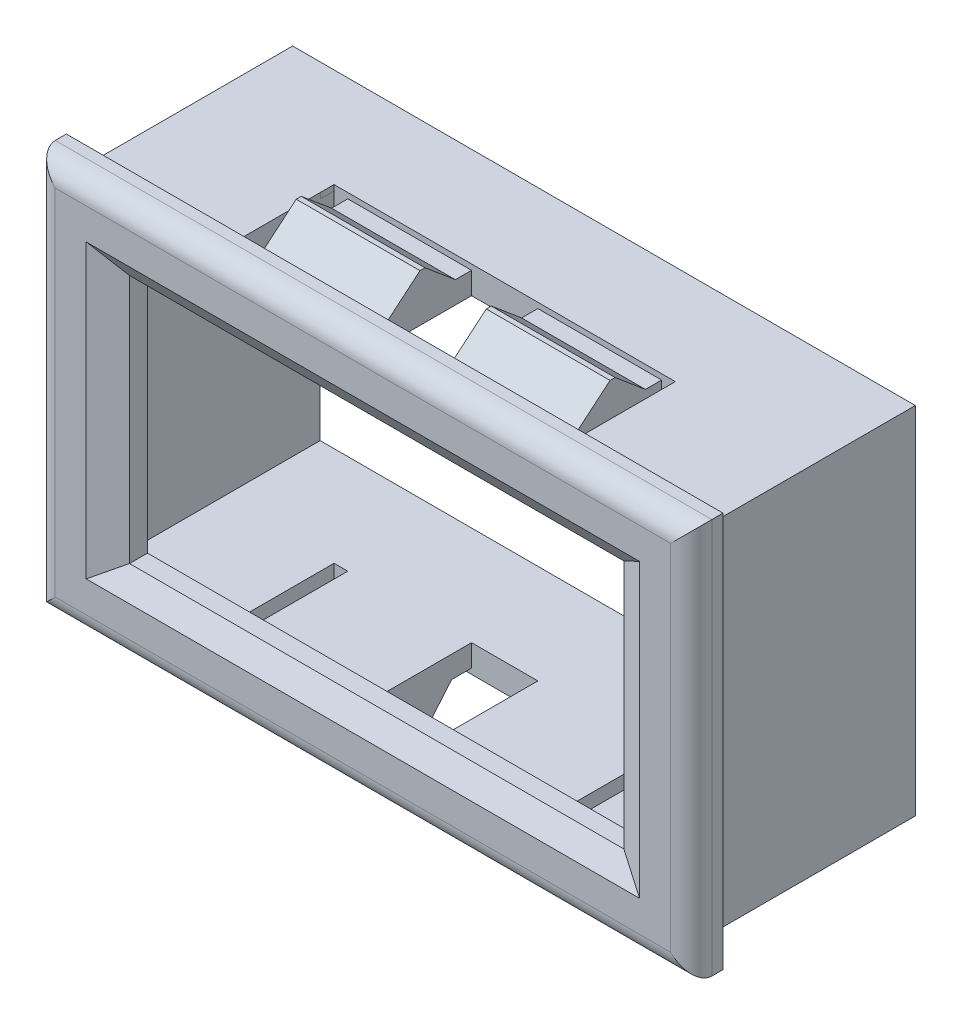
from build123d import *
from OCP.BRepFilletAPI import BRepFilletAPI_MakeChamfer

# Parameters (mm, degrees)
ESBO_O1_W                  = 47.75
ESBO_O1_H                  = 28.75
RESSALTO_EXTRUS_O1_DEPTH   = 17.53
ESBO_O3_W                  = 55.113346814
ESBO_O3_H                  = 32.23245858
ESBO_O3_W_2                = 45.28
ESBO_O3_H_2                = 25.85
CORTE_EXTRUS_O1_DEPTH      = 15.22
CORTE_EXTRUS_O2_DEPTH      = 17
CORTE_EXTRUS_O2_DEPTH_BACK = 33.22
ESBO_O4_W                  = 35.95
ESBO_O4_H                  = 18.14
ESBO_O5_W                  = 41.28
ESBO_O5_H                  = 21.85
CORTE_EXTRUS_O3_DEPTH      = 15.22
CHANFRO1_SIZE              = 1
CHANFRO1_SIZE2             = 2.144506921
CHANFRO2_SIZE              = 1
CHANFRO2_SIZE2             = 2.144506921
CHANFRO3_SIZE              = 1
CHANFRO3_SIZE2             = 1.539864964
FILETE1_R                  = 1.5
CORTE_EXTRUS_O4_DEPTH      = 15
CORTE_EXTRUS_O4_DEPTH_BACK = 44.22
CORTE_EXTRUS_O5_DEPTH      = 0.4
ESBO_O8_W                  = 24.82
ESBO_O8_H                  = 1
CORTE_EXTRUS_O6_DEPTH      = 0.4
ESBO_O9_W                  = 9
ESBO_O9_H                  = 6.324480946
RESSALTO_EXTRUS_O2_DEPTH   = 1.45
ESBO_O10_W                 = 9
ESBO_O10_H                 = 6.324480946
RESSALTO_EXTRUS_O3_DEPTH   = 1.45
ESBO_O11_W                 = 9
ESBO_O11_H                 = 6.324480946
RESSALTO_EXTRUS_O4_DEPTH   = 1.45
CHANFRO4_SIZE              = 3
CHANFRO4_SIZE2             = 3.575260778


with BuildPart() as part:
    # Esboço1 → Ressalto-extrusão1 (new body)
    with BuildSketch(Plane.XY):
        Rectangle(ESBO_O1_W, ESBO_O1_H)
    extrude(amount=RESSALTO_EXTRUS_O1_DEPTH)

    # Esboço3 → Corte-extrusão1 (cut)
    with BuildSketch(Plane(origin=(0, 0, 0), x_dir=(-1, 0, 0), z_dir=(0, 0, -1))):
        Rectangle(ESBO_O3_W, ESBO_O3_H)
        Rectangle(ESBO_O3_W_2, ESBO_O3_H_2, mode=Mode.SUBTRACT)
    extrude(amount=-CORTE_EXTRUS_O1_DEPTH, mode=Mode.SUBTRACT)

    # Esboço4 → Corte-extrusão2 (cut, two sides: drawn at the far end of the back side and taken through both)
    with BuildSketch(Plane.XY.offset(17.53).offset(-CORTE_EXTRUS_O2_DEPTH_BACK)):
        Rectangle(ESBO_O4_W, ESBO_O4_H)
    extrude(amount=CORTE_EXTRUS_O2_DEPTH + CORTE_EXTRUS_O2_DEPTH_BACK, mode=Mode.SUBTRACT)

    # Esboço5 → Corte-extrusão3 (cut)
    with BuildSketch(Plane(origin=(0, 0, 0), x_dir=(-1, 0, 0), z_dir=(0, 0, -1))):
        Rectangle(ESBO_O5_W, ESBO_O5_H)
    extrude(amount=-CORTE_EXTRUS_O3_DEPTH, mode=Mode.SUBTRACT)

    # Chanfro1
    chanfro1_edges = [part.edges().sort_by_distance(p)[0] for p in [
        (17.975, 0, 17.53),
    ]]
    chanfro1_side = [part.faces().sort_by_distance(p)[0] for p in [
        (17.975, 0, 16.375),
    ]]
    chamfer(chanfro1_edges, length=CHANFRO1_SIZE, length2=CHANFRO1_SIZE2, reference=chanfro1_side[0])

    # Chanfro2
    chanfro2_edges = [part.edges().sort_by_distance(p)[0] for p in [
        (-17.975, 0, 17.53),
    ]]
    chanfro2_side = [part.faces().sort_by_distance(p)[0] for p in [
        (-17.975, 0, 16.375),
    ]]
    chamfer(chanfro2_edges, length=CHANFRO2_SIZE, length2=CHANFRO2_SIZE2, reference=chanfro2_side[0])

    # Chanfro3: one chamfer whose edges measure the first distance from different faces: ONE call of the kernel's chamfer builder (chamfer() names one face for all edges)
    chanfro3_edges_1 = [part.edges().sort_by_distance(p)[0] for p in [
        (0, -9.07, 17.53),
    ]]
    chanfro3_side_1 = [part.faces().sort_by_distance(p)[0] for p in [
        (0, -9.07, 16.39568424),
    ]]
    chanfro3_edges_2 = [part.edges().sort_by_distance(p)[0] for p in [
        (0, 9.07, 17.53),
    ]]
    chanfro3_side_2 = [part.faces().sort_by_distance(p)[0] for p in [
        (0, 9.07, 16.39568424),
    ]]
    chanfro3 = BRepFilletAPI_MakeChamfer(part.part.solid().wrapped)
    for e in chanfro3_edges_1:
        chanfro3.Add(CHANFRO3_SIZE, CHANFRO3_SIZE2, e.wrapped, chanfro3_side_1[0].wrapped)  # the first distance lies on this face
    for e in chanfro3_edges_2:
        chanfro3.Add(CHANFRO3_SIZE, CHANFRO3_SIZE2, e.wrapped, chanfro3_side_2[0].wrapped)  # the first distance lies on this face
    add(Compound.cast(chanfro3.Shape()), mode=Mode.REPLACE)

    # Filete1
    filete1_edges = [part.edges().sort_by_distance(p)[0] for p in [
        (23.875, 0, 17.53),
        (0, 14.375, 17.53),
        (-23.875, 0, 17.53),
        (0, -14.375, 17.53),
    ]]
    fillet(filete1_edges, radius=FILETE1_R)

    # Esboço6 → Corte-extrusão4 (cut, two sides: drawn at the far end of the back side and taken through both)
    with BuildSketch(Plane(origin=(0, 12.925, 0), x_dir=(1, 0, 0), z_dir=(0, 1, 0)).offset(-CORTE_EXTRUS_O4_DEPTH_BACK)):
        Polygon((-11.41, -7.895519054), (-11.41, -7.22), (-12.41, -7.22), (-12.41, -15.22), (12.41, -15.22), (12.41, -7.22), (11.41, -7.22), (11.41, -7.895519054), (11.41, -14.544480946), (2.41, -14.544480946), (2.41, -7.22), (-2.41, -7.22), (-2.41, -14.544480946), (-11.41, -14.544480946), align=None)
    extrude(amount=CORTE_EXTRUS_O4_DEPTH + CORTE_EXTRUS_O4_DEPTH_BACK, mode=Mode.SUBTRACT)

    # Esboço7 → Corte-extrusão5 (cut)
    with BuildSketch(Plane(origin=(0, 12.925, 0), x_dir=(1, 0, 0), z_dir=(0, 1, 0))):
        Polygon((-12.410087555, -8.22), (12.410087555, -8.22), (12.41, -7.22), (-12.41, -7.22), align=None)
    extrude(amount=-CORTE_EXTRUS_O5_DEPTH, mode=Mode.SUBTRACT)

    # Esboço8 → Corte-extrusão6 (cut)
    with BuildSketch(Plane.XZ.offset(12.925)):
        with Locations((0, 7.72)):
            Rectangle(ESBO_O8_W, ESBO_O8_H)
    extrude(amount=-CORTE_EXTRUS_O6_DEPTH, mode=Mode.SUBTRACT)

    # Esboço9 → Ressalto-extrusão2 (add)
    with BuildSketch(Plane(origin=(0, 12.925, 0), x_dir=(1, 0, 0), z_dir=(0, 1, 0))):
        with Locations((-6.91, -11.382240473)):
            Rectangle(ESBO_O9_W, ESBO_O9_H)
    extrude(amount=RESSALTO_EXTRUS_O2_DEPTH)

    # Esboço10 → Ressalto-extrusão3 (add)
    with BuildSketch(Plane(origin=(0, 12.925, 0), x_dir=(1, 0, 0), z_dir=(0, 1, 0))):
        with Locations((6.91, -11.382240473)):
            Rectangle(ESBO_O10_W, ESBO_O10_H)
    extrude(amount=RESSALTO_EXTRUS_O3_DEPTH)

    # Esboço11 → Ressalto-extrusão4 (add)
    with BuildSketch(Plane.XZ.offset(12.925)):
        with Locations((6.91, 11.382240473)):
            Rectangle(ESBO_O11_W, ESBO_O11_H)
        Polygon((-2.41, 8.22), (-2.41, 14.544480946), (-6.91, 14.544480946), (-11.41, 14.544480946), (-11.41, 8.22), align=None)
    extrude(amount=RESSALTO_EXTRUS_O4_DEPTH)

    # Chanfro4: one chamfer whose edges measure the first distance from different faces: ONE call of the kernel's chamfer builder (chamfer() names one face for all edges)
    chanfro4_edges_1 = [part.edges().sort_by_distance(p)[0] for p in [
        (-6.91, 14.375, 14.544480946),
    ]]
    chanfro4_side_1 = [part.faces().sort_by_distance(p)[0] for p in [
        (-6.91, 12.65, 14.544480946),
    ]]
    chanfro4_edges_2 = [part.edges().sort_by_distance(p)[0] for p in [
        (6.91, 14.375, 14.544480946),
    ]]
    chanfro4_side_2 = [part.faces().sort_by_distance(p)[0] for p in [
        (6.91, 12.65, 14.544480946),
    ]]
    chanfro4_edges_3 = [part.edges().sort_by_distance(p)[0] for p in [
        (6.91, -14.375, 14.544480946),
    ]]
    chanfro4_side_3 = [part.faces().sort_by_distance(p)[0] for p in [
        (6.91, -12.65, 14.544480946),
    ]]
    chanfro4_edges_4 = [part.edges().sort_by_distance(p)[0] for p in [
        (-6.91, -14.375, 14.544480946),
    ]]
    chanfro4_side_4 = [part.faces().sort_by_distance(p)[0] for p in [
        (-6.91, -12.65, 14.544480946),
    ]]
    chanfro4 = BRepFilletAPI_MakeChamfer(part.part.solid().wrapped)
    for e in chanfro4_edges_1:
        chanfro4.Add(CHANFRO4_SIZE, CHANFRO4_SIZE2, e.wrapped, chanfro4_side_1[0].wrapped)  # the first distance lies on this face
    for e in chanfro4_edges_2:
        chanfro4.Add(CHANFRO4_SIZE, CHANFRO4_SIZE2, e.wrapped, chanfro4_side_2[0].wrapped)  # the first distance lies on this face
    for e in chanfro4_edges_3:
        chanfro4.Add(CHANFRO4_SIZE, CHANFRO4_SIZE2, e.wrapped, chanfro4_side_3[0].wrapped)  # the first distance lies on this face
    for e in chanfro4_edges_4:
        chanfro4.Add(CHANFRO4_SIZE, CHANFRO4_SIZE2, e.wrapped, chanfro4_side_4[0].wrapped)  # the first distance lies on this face
    add(Compound.cast(chanfro4.Shape()), mode=Mode.REPLACE)

    # Chanfro5
    # the kernel refuses this chamfer: 2.383507185, 2 mm, written as the material it takes off along each edge
    with BuildSketch(Plane(origin=(-11.41, 14.375, 8.22), x_dir=(0, 0.024939322090234445, 0.9996889667359941), z_dir=(1, 0, 0))) as chanfro5_piece_1_section:
        with BuildLine():
            Line((2.457306387, 0), (-0.124419196, 2.058820987))
            Line((-0.124419196, 2.058820987), (-0.172074512, 2.057632126))
            ThreePointArc((-0.172074512, 2.057632126), (-0.073358824, 1.029132353), (-0.047655317, -0.001188861))
            Line((-0.047655317, -0.001188861), (0.001188861, -0.047655317))
            ThreePointArc((0.001188861, -0.047655317), (1.229077869, -0.01702307), (2.458495248, -0.047655317))
            Line((2.458495248, -0.047655317), (2.457306387, 0))
        make_face()
    chanfro5_piece_1 = extrude(amount=9, mode=Mode.PRIVATE)
    chanfro5_piece_1 = split(chanfro5_piece_1, bisect_by=Plane(origin=(-6.91, 12.525, 9.020332746), z_dir=(0, 1, 0)), keep=Keep.TOP, mode=Mode.PRIVATE)
    add(chanfro5_piece_1, mode=Mode.SUBTRACT)
    with BuildSketch(Plane(origin=(11.41, 14.375, 8.22), x_dir=(0, 0.024939322090234445, 0.9996889667359941), z_dir=(-1, 0, 0))) as chanfro5_piece_2_section:
        with BuildLine():
            Line((2.457306387, 0), (-0.124419196, -2.058820987))
            Line((-0.124419196, -2.058820987), (-0.172074512, -2.057632126))
            ThreePointArc((-0.172074512, -2.057632126), (-0.073358824, -1.029132353), (-0.047655317, 0.001188861))
            Line((-0.047655317, 0.001188861), (0.001188861, 0.047655317))
            ThreePointArc((0.001188861, 0.047655317), (1.229077869, 0.01702307), (2.458495248, 0.047655317))
            Line((2.458495248, 0.047655317), (2.457306387, 0))
        make_face()
    chanfro5_piece_2 = extrude(amount=9, mode=Mode.PRIVATE)
    chanfro5_piece_2 = split(chanfro5_piece_2, bisect_by=Plane(origin=(6.91, 12.525, 9.020332746), z_dir=(0, 1, 0)), keep=Keep.TOP, mode=Mode.PRIVATE)
    add(chanfro5_piece_2, mode=Mode.SUBTRACT)
    with BuildSketch(Plane(origin=(2.41, -14.375, 8.22), x_dir=(0, -0.024939322090234445, 0.9996889667359941), z_dir=(1, 0, 0))) as chanfro5_piece_3_section:
        with BuildLine():
            Line((2.457306387, 0), (-0.124419196, -2.058820987))
            Line((-0.124419196, -2.058820987), (-0.172074512, -2.057632126))
            ThreePointArc((-0.172074512, -2.057632126), (-0.073358824, -1.029132353), (-0.047655317, 0.001188861))
            Line((-0.047655317, 0.001188861), (0.001188861, 0.047655317))
            ThreePointArc((0.001188861, 0.047655317), (1.229077869, 0.01702307), (2.458495248, 0.047655317))
            Line((2.458495248, 0.047655317), (2.457306387, 0))
        make_face()
    chanfro5_piece_3 = extrude(amount=9, mode=Mode.PRIVATE)
    chanfro5_piece_3 = split(chanfro5_piece_3, bisect_by=Plane(origin=(6.91, -12.525, 9.020332746), z_dir=(0, -1, 0)), keep=Keep.TOP, mode=Mode.PRIVATE)
    add(chanfro5_piece_3, mode=Mode.SUBTRACT)
    with BuildSketch(Plane(origin=(-11.41, -14.375, 8.22), x_dir=(0, -0.03540953691366296, 0.9993728857116145), z_dir=(1, 0, 0))) as chanfro5_piece_4_section:
        with BuildLine():
            Line((2.062577027, 0), (-0.148230141, -2.452831528))
            Line((-0.148230141, -2.452831528), (-0.19587039, -2.45114355))
            ThreePointArc((-0.19587039, -2.45114355), (-0.091132758, -1.225812797), (-0.047640249, 0.001687978))
            Line((-0.047640249, 0.001687978), (0.001687978, 0.047640249))
            ThreePointArc((0.001687978, 0.047640249), (1.031683425, 0.011145701), (2.064265005, 0.047640249))
            Line((2.064265005, 0.047640249), (2.062577027, 0))
        make_face()
    chanfro5_piece_4 = extrude(amount=9, mode=Mode.PRIVATE)
    chanfro5_piece_4 = split(chanfro5_piece_4, bisect_by=Plane(origin=(-6.91, -12.525, 8.913974099), z_dir=(0, -1, 0)), keep=Keep.TOP, mode=Mode.PRIVATE)
    add(chanfro5_piece_4, mode=Mode.SUBTRACT)


solid = part.part
